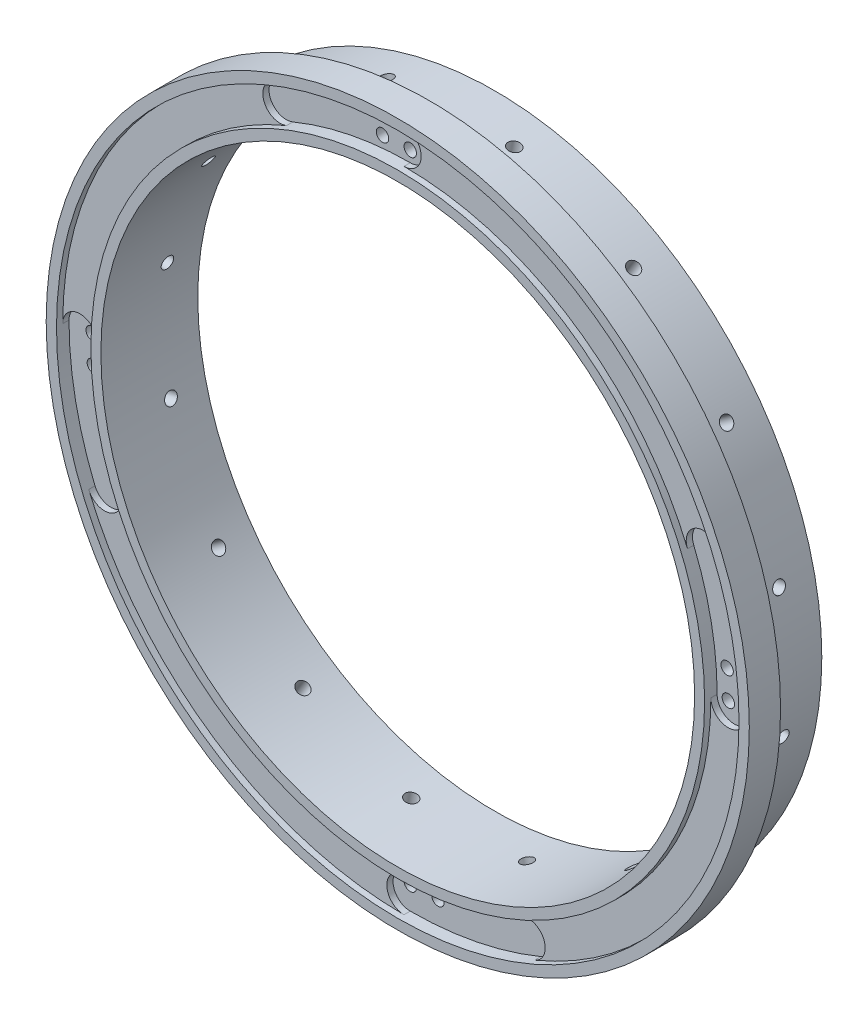
from build123d import *
from build123d.topology import SkipClean

# Parameters (mm, degrees)
SKETCH1_R                    = 71.4375
EXTRUDE1_DEPTH               = 19.685
SKETCH2_R                    = 60.325
EXTRUDE2_DEPTH               = 103.92780012
SKETCH3_OUTSIDE_W            = 185.478
SKETCH3_OUTSIDE_H            = 185.478
SKETCH3_OUTSIDE_R            = 66.4845
EXTRUDE3_DEPTH               = 13.335
SKETCH4_R                    = 69.342
SKETCH4_R_2                  = 62.357
EXTRUDE4_DEPTH               = 1.27
EXTRUDE6_START               = 103.692477999
EXTRUDE6_DEPTH               = 104.962477999
CIRPATTERN1_COUNT            = 4
F_39_0_0995_DIAMETER_HOLE1_D = 2.5273
CIRPATTERN2_COUNT            = 4
CIRPATTERN4_COUNT            = 16


with BuildPart() as part:
    # Sketch1 → Extrude1 (new body)
    with BuildSketch(Plane.XY):
        Circle(SKETCH1_R)
    extrude(amount=EXTRUDE1_DEPTH)

    # Sketch2 → Extrude2 (cut, through all)
    with BuildSketch(Plane.XY.offset(19.685)):
        Circle(SKETCH2_R)
    extrude(amount=-EXTRUDE2_DEPTH, mode=Mode.SUBTRACT)

    # Sketch3 outside → Extrude3 (cut)
    with BuildSketch(Plane(origin=(0, 0, 0), x_dir=(-1, 0, 0), z_dir=(0, 0, -1))):
        Rectangle(SKETCH3_OUTSIDE_W, SKETCH3_OUTSIDE_H)
        Circle(SKETCH3_OUTSIDE_R, mode=Mode.SUBTRACT)
    extrude(amount=-EXTRUDE3_DEPTH, mode=Mode.SUBTRACT)

    # Sketch4 → Extrude4 (cut)
    with BuildSketch(Plane.XY.offset(19.685)):
        Circle(SKETCH4_R)
        Circle(SKETCH4_R_2, mode=Mode.SUBTRACT)
    extrude(amount=-EXTRUDE4_DEPTH, mode=Mode.SUBTRACT)

    # Sketch7 → Extrude6 (cut)
    with BuildSketch(Plane.XY.offset(18.415).offset(EXTRUDE6_START)):
        with BuildLine():
            ThreePointArc((0, 69.342), (-13.527953109, 68.009612914), (-26.536034567, 64.063654543))
            ThreePointArc((-26.536034567, 64.063654543), (-28.426161947, 59.500483389), (-23.862990792, 57.610356009))
            ThreePointArc((-23.862990792, 57.610356009), (-12.16524721, 61.15882773), (0, 62.357))
            ThreePointArc((0, 62.357), (3.4925, 65.8495), (0, 69.342))
        make_face()
    extrude6 = extrude(amount=-EXTRUDE6_DEPTH, mode=Mode.SUBTRACT)

    # CirPattern1: Extrude6 ×4 about axis
    with SkipClean():  # the faces are left unmerged after this step: merging them gives an invalid solid
        cirpattern1_axis = Axis((0, 0, 0), (0, 0, 1))
        for i in range(1, CIRPATTERN1_COUNT):
            add(extrude6.rotate(cirpattern1_axis, i * 360 / CIRPATTERN1_COUNT), mode=Mode.SUBTRACT)
    add(part.part.scale(1), mode=Mode.REPLACE)  # the faces are merged on a copy

    # #39 (0.0995) Diameter Hole1 (through all)
    with Locations(Plane(origin=(0, 64.632701659, 17.145), x_dir=(1, 0, 0), z_dir=(0, 0, 1))):
        with Locations((0, 0), (-5.633111119, -0.245946943)):
            f_39_0_0995_diameter_hole1 = Hole(F_39_0_0995_DIAMETER_HOLE1_D / 2)

    # CirPattern2: #39 (0.0995) Diameter Hole1 ×4 about axis
    cirpattern2_axis = Axis((0, 0, 0), (0, 0, 1))
    for i in range(1, CIRPATTERN2_COUNT):
        add(f_39_0_0995_diameter_hole1.rotate(cirpattern2_axis, i * 360 / CIRPATTERN2_COUNT), mode=Mode.SUBTRACT)

    # Sketch16 → #39 (0.0995) Diameter Hole5 (revolve, cut)
    with BuildSketch(Plane(origin=(64.780506572, 14.955758373, 6.985), x_dir=(-0.22495105434385887, 0.9743700647852368, 0), z_dir=(0, 0, 1))):
        Polygon((0, 0), (0, 13.459277521), (1.26365, 12.7), (1.26365, 0), align=None)
    f_39_0_0995_diameter_hole5 = revolve(axis=Axis((70.967756484, 16.384197568, 6.985), (-0.9743700647852366, -0.22495105434385881, 0)), mode=Mode.SUBTRACT)

    # CirPattern4: #39 (0.0995) Diameter Hole5 ×16 about axis
    cirpattern4_axis = Axis((0, 0, 0), (0, 0, 1))
    for i in range(1, CIRPATTERN4_COUNT):
        add(f_39_0_0995_diameter_hole5.rotate(cirpattern4_axis, i * 360 / CIRPATTERN4_COUNT), mode=Mode.SUBTRACT)


solid = part.part
